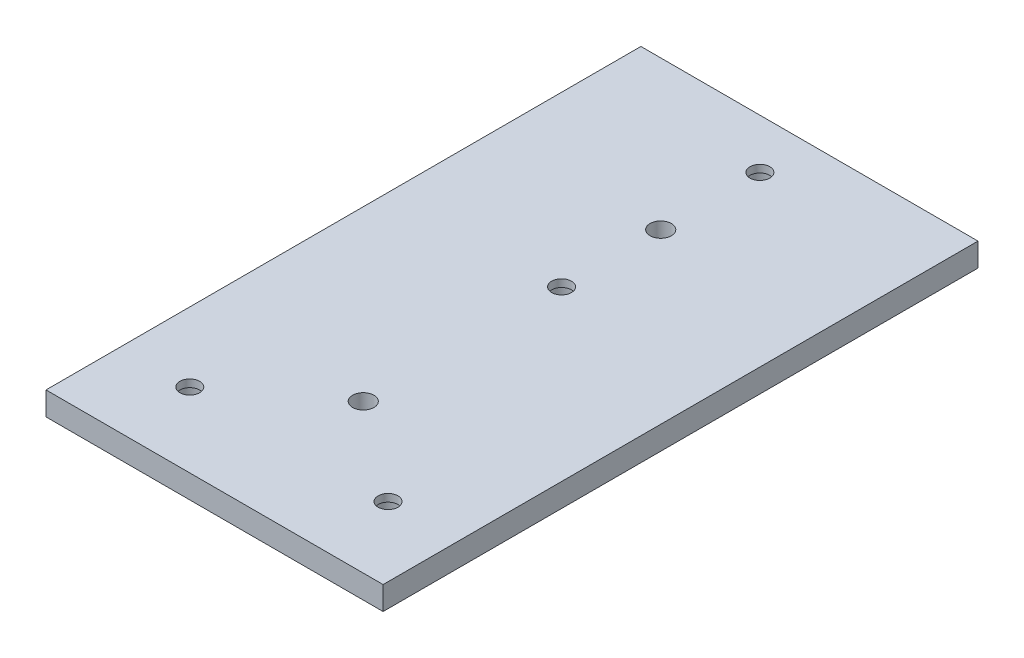
from build123d import *

# Parameters (mm, degrees)
SKETCH2_W               = 88.9
SKETCH2_H               = 152.4
BOSS_EXTRUDE1_DEPTH     = 5.9944
CUT_EXTRUDE2_DEPTH      = 177.535840076
CUT_EXTRUDE2_DEPTH_BACK = 177.535840076
SKETCH4_R               = 2.7305
CUT_EXTRUDE3_DEPTH      = 177.535840076
CUT_EXTRUDE3_DEPTH_BACK = 177.535840076
SKETCH7_W               = 2.54
SKETCH7_H               = 152.4
CUT_EXTRUDE4_DEPTH      = 177.535840076
CUT_EXTRUDE4_DEPTH_BACK = 177.535840076
SKETCH8_R               = 2.54
SKETCH9_R               = 3.683
CUT_EXTRUDE5_DEPTH      = 4.064


with BuildPart() as part:
    # Sketch2 → Boss-Extrude1 (new body)
    with BuildSketch(Plane(origin=(0, 0, 0), x_dir=(1, 0, 0), z_dir=(0, 1, 0))):
        with Locations((44.45, 76.2)):
            Rectangle(SKETCH2_W, SKETCH2_H)
    extrude(amount=BOSS_EXTRUDE1_DEPTH)

    # Sketch4 → Cut-Extrude2 (cut, two sides: drawn at the far end of the back side and taken through both)
    with BuildSketch(Plane(origin=(0, 5.9944, 0), x_dir=(1, 0, 0), z_dir=(0, 1, 0)).offset(-CUT_EXTRUDE2_DEPTH_BACK)):
        with Locations((45.72, 114.3)):
            Circle(SKETCH4_R)
        with Locations((45.72, 38.1)):
            Circle(SKETCH4_R)
    extrude(amount=CUT_EXTRUDE2_DEPTH + CUT_EXTRUDE2_DEPTH_BACK, mode=Mode.SUBTRACT)

    # Sketch7 → Cut-Extrude3 (cut, two sides: drawn at the far end of the back side and taken through both)
    with BuildSketch(Plane(origin=(0, 5.9944, 0), x_dir=(1, 0, 0), z_dir=(0, 1, 0)).offset(-CUT_EXTRUDE3_DEPTH_BACK)):
        with Locations((1.27, 76.2)):
            Rectangle(SKETCH7_W, SKETCH7_H)
    extrude(amount=CUT_EXTRUDE3_DEPTH + CUT_EXTRUDE3_DEPTH_BACK, mode=Mode.SUBTRACT)

    # Sketch8 → Cut-Extrude4 (cut, two sides: drawn at the far end of the back side and taken through both)
    with BuildSketch(Plane(origin=(0, 5.9944, 0), x_dir=(1, 0, 0), z_dir=(0, 1, 0)).offset(-CUT_EXTRUDE4_DEPTH_BACK)):
        with Locations((20.32, 19.05)):
            Circle(SKETCH8_R)
        with Locations((71.12, 19.05)):
            Circle(SKETCH8_R)
        with Locations((45.72, 88.9)):
            Circle(SKETCH8_R)
        with Locations((45.72, 139.7)):
            Circle(SKETCH8_R)
    extrude(amount=CUT_EXTRUDE4_DEPTH + CUT_EXTRUDE4_DEPTH_BACK, mode=Mode.SUBTRACT)

    # Sketch9 → Cut-Extrude5 (cut)
    with BuildSketch(Plane.XZ):
        with Locations((20.32, -19.05)):
            Circle(SKETCH9_R)
        with Locations((71.12, -19.05)):
            Circle(SKETCH9_R)
        with Locations((45.72, -88.9)):
            Circle(SKETCH9_R)
        with Locations((45.72, -139.7)):
            Circle(SKETCH9_R)
    extrude(amount=-CUT_EXTRUDE5_DEPTH, mode=Mode.SUBTRACT)


solid = part.part
